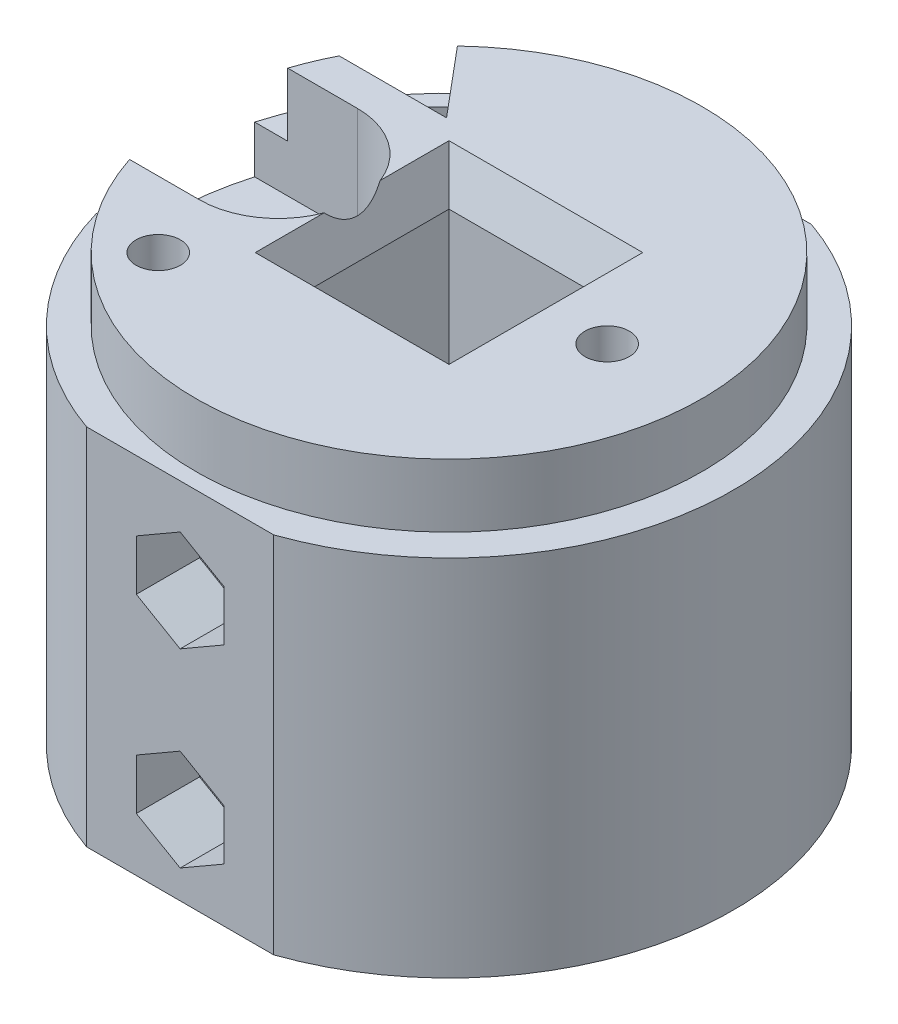
from build123d import *

# Parameters (mm, degrees)
SKETCH1_R           = 18
SKETCH1_R_2         = 2
SKETCH1_W           = 10.25
SKETCH1_H           = 10.25
BOSS_EXTRUDE1_DEPTH = 27
CUT_EXTRUDE1_START  = -7
CUT_EXTRUDE1_DEPTH  = 7
SKETCH4_W           = 9.35
SKETCH4_H           = 9.35
CUT_EXTRUDE3_DEPTH  = 15.4
CUT_EXTRUDE4_START  = -40
CUT_EXTRUDE4_DEPTH  = 40
SKETCH6_R           = 1.5
CUT_EXTRUDE5_DEPTH  = 48
SKETCH7_R           = 3
CUT_EXTRUDE6_DEPTH  = 3
CUT_EXTRUDE7_DEPTH  = 4
CHAMFER1_SIZE       = 1
CHAMFER1_SIZE_2     = 2.747477419
CUT_EXTRUDE8_DEPTH  = 37.633318168
SKETCH12_R          = 1.4
CUT_EXTRUDE10_DEPTH = 20
CUT_EXTRUDE9_START  = -4
SKETCH10_R          = 18
SKETCH10_R_2        = 16
CUT_EXTRUDE9_DEPTH  = 4


with BuildPart() as part:
    # Sketch1 → Boss-Extrude1 (new body)
    with BuildSketch(Plane(origin=(0, 0, 0), x_dir=(1, 0, 0), z_dir=(0, 1, 0))):
        with Locations(Location((0, 0, 0), (0, 0, 270))):
            Circle(SKETCH1_R)
        with Locations(Location((-12, 0, 0), (0, 0, 270))):
            Circle(SKETCH1_R_2, mode=Mode.SUBTRACT)
        Rectangle(SKETCH1_W, SKETCH1_H, mode=Mode.SUBTRACT)
    extrude(amount=BOSS_EXTRUDE1_DEPTH)

    # Sketch2 → Cut-Extrude1 (cut)
    with BuildSketch(Plane(origin=(0, 27, 0), x_dir=(1, 0, 0), z_dir=(0, 1, 0)).offset(CUT_EXTRUDE1_START)):
        with BuildLine():
            Line((-10.8, 5), (-17.291616466, 5))
            ThreePointArc((-17.291616466, 5), (-18, 0), (-17.291616466, -5))
            Line((-17.291616466, -5), (-10.8, -5))
            ThreePointArc((-10.8, -5), (-5.8, 0), (-10.8, 5))
        make_face()
    extrude(amount=CUT_EXTRUDE1_DEPTH, mode=Mode.SUBTRACT)

    # Sketch4 → Cut-Extrude3 (cut)
    with BuildSketch(Plane(origin=(0, 0, 0), x_dir=(-1, 0, 0), z_dir=(0, -1, 0))):
        with Locations((11.135393506, 0.872889968)):
            Rectangle(SKETCH4_W, SKETCH4_H)
    extrude(amount=-CUT_EXTRUDE3_DEPTH, mode=Mode.SUBTRACT)

    # Sketch5 → Cut-Extrude4 (cut)
    with BuildSketch(Plane(origin=(0, 27, 0), x_dir=(1, 0, 0), z_dir=(0, 1, 0)).offset(CUT_EXTRUDE4_START)):
        with BuildLine():
            Line((5.916079783, 17), (-5.916079783, 17))
            ThreePointArc((-5.916079783, 17), (0, 18), (5.916079783, 17))
        make_face()
        with BuildLine():
            Line((5.916079783, -17), (-5.916079783, -17))
            ThreePointArc((-5.916079783, -17), (0, -18), (5.916079783, -17))
        make_face()
    extrude(amount=CUT_EXTRUDE4_DEPTH, mode=Mode.SUBTRACT)

    # Sketch6 → Cut-Extrude5 (cut, through all)
    with BuildSketch(Plane(origin=(0, 0, -17), x_dir=(-1, 0, 0), z_dir=(0, 0, -1))):
        with Locations((0, 17)):
            Circle(SKETCH6_R)
        with Locations((0, 5)):
            Circle(SKETCH6_R)
    extrude(amount=-CUT_EXTRUDE5_DEPTH, mode=Mode.SUBTRACT)

    # Sketch7 → Cut-Extrude6 (cut)
    with BuildSketch(Plane(origin=(0, 0, -17), x_dir=(-1, 0, 0), z_dir=(0, 0, -1))):
        with Locations((0, 17)):
            Circle(SKETCH7_R)
        with Locations((0, 5)):
            Circle(SKETCH7_R)
    extrude(amount=-CUT_EXTRUDE6_DEPTH, mode=Mode.SUBTRACT)

    # Sketch8 → Cut-Extrude7 (cut)
    with BuildSketch(Plane.XY.offset(17)):
        Polygon((0, 13.8), (2.771281292, 15.4), (2.771281292, 18.6), (0, 20.2), (-2.771281292, 18.6), (-2.771281292, 15.4), align=None)
        Polygon((0, 1.8), (2.771281292, 3.4), (2.771281292, 6.6), (0, 8.2), (-2.771281292, 6.6), (-2.771281292, 3.4), align=None)
    extrude(amount=-CUT_EXTRUDE7_DEPTH, mode=Mode.SUBTRACT)

    # Chamfer1
    # the kernel refuses this chamfer: 2.747477419, 1 mm, written as the material it takes off along each edge
    with BuildSketch(Plane(origin=(-5.125, 27, -5.125), x_dir=(0, 0.09904090225204956, -0.9950833631817488), z_dir=(1, 0, 0)), Plane(origin=(-5.125, 27, 5.125), x_dir=(-0.9950833631817488, 0.09904090225204956, 0), z_dir=(0, 0, -1)), Plane(origin=(5.125, 27, 5.125), x_dir=(0, 0.09904090225204956, 0.9950833631817488), z_dir=(-1, 0, 0)), Plane(origin=(5.125, 27, -5.125), x_dir=(0.9950833631817488, 0.09904090225204956, 0), z_dir=(0, 0, 1))) as chamfer1_piece_1:
        Polygon((CHAMFER1_SIZE * 0.995083363182, -CHAMFER1_SIZE * 0.099040902252), (-CHAMFER1_SIZE_2 * 0.0990409022684, -CHAMFER1_SIZE_2 * 0.995083363346), (0, 0), align=None)
    extrude(amount=10.25, mode=Mode.SUBTRACT)
    with BuildSketch(Plane(origin=(-5.125, 27, 5.125), x_dir=(-0.9950833631817488, 0.09904090225204956, 0), z_dir=(0, 0, -1))) as chamfer1_piece_2a_section:
        Polygon((CHAMFER1_SIZE * 0.995083363182, -CHAMFER1_SIZE * 0.099040902252), (-CHAMFER1_SIZE_2 * 0.0990409022684, -CHAMFER1_SIZE_2 * 0.995083363346), (0, 0), align=None)
    chamfer1_piece_2a = extrude(amount=17.377491449, mode=Mode.PRIVATE)
    chamfer1_piece_2a = split(chamfer1_piece_2a, bisect_by=Plane(origin=(-5.432505006, 26.059901151, -5.125), z_dir=(0, 0, -1)), keep=Keep.TOP, mode=Mode.PRIVATE)
    with BuildSketch(Plane(origin=(-12.252491449, 27, -5.125), x_dir=(0, 0.09904090225204956, -0.9950833631817488), z_dir=(1, 0, 0))) as chamfer1_piece_2b_section:
        Polygon((CHAMFER1_SIZE * 0.995083363182, -CHAMFER1_SIZE * 0.099040902252), (-CHAMFER1_SIZE_2 * 0.0990409022684, -CHAMFER1_SIZE_2 * 0.995083363346), (0, 0), align=None)
    chamfer1_piece_2b = extrude(amount=17.377491449, mode=Mode.PRIVATE)
    chamfer1_piece_2b = split(chamfer1_piece_2b, bisect_by=Plane(origin=(-5.125, 26.059901151, -5.432505006), z_dir=(-1, 0, 0)), keep=Keep.TOP, mode=Mode.PRIVATE)
    chamfer1_piece_2 = chamfer1_piece_2a & chamfer1_piece_2b
    add(chamfer1_piece_2, mode=Mode.SUBTRACT)
    with BuildSketch(Plane(origin=(5.125, 27, -12.252491449), x_dir=(0.9950833631817488, 0.09904090225204956, 0), z_dir=(0, 0, 1))) as chamfer1_piece_3a_section:
        Polygon((CHAMFER1_SIZE * 0.995083363182, -CHAMFER1_SIZE * 0.099040902252), (-CHAMFER1_SIZE_2 * 0.0990409022684, -CHAMFER1_SIZE_2 * 0.995083363346), (0, 0), align=None)
    chamfer1_piece_3a = extrude(amount=17.377491449, mode=Mode.PRIVATE)
    chamfer1_piece_3a = split(chamfer1_piece_3a, bisect_by=Plane(origin=(5.432505006, 26.059901151, -5.125), z_dir=(0, 0, -1)), keep=Keep.TOP, mode=Mode.PRIVATE)
    with BuildSketch(Plane(origin=(-5.125, 27, -5.125), x_dir=(0, 0.09904090225204956, -0.9950833631817488), z_dir=(1, 0, 0))) as chamfer1_piece_3b_section:
        Polygon((CHAMFER1_SIZE * 0.995083363182, -CHAMFER1_SIZE * 0.099040902252), (-CHAMFER1_SIZE_2 * 0.0990409022684, -CHAMFER1_SIZE_2 * 0.995083363346), (0, 0), align=None)
    chamfer1_piece_3b = extrude(amount=17.377491449, mode=Mode.PRIVATE)
    chamfer1_piece_3b = split(chamfer1_piece_3b, bisect_by=Plane(origin=(5.125, 26.059901151, -5.432505006), z_dir=(1, 0, 0)), keep=Keep.TOP, mode=Mode.PRIVATE)
    chamfer1_piece_3 = chamfer1_piece_3a & chamfer1_piece_3b
    add(chamfer1_piece_3, mode=Mode.SUBTRACT)
    with BuildSketch(Plane(origin=(5.125, 27, 5.125), x_dir=(0, 0.09904090225204956, 0.9950833631817488), z_dir=(-1, 0, 0))) as chamfer1_piece_4a_section:
        Polygon((CHAMFER1_SIZE * 0.995083363182, -CHAMFER1_SIZE * 0.099040902252), (-CHAMFER1_SIZE_2 * 0.0990409022684, -CHAMFER1_SIZE_2 * 0.995083363346), (0, 0), align=None)
    chamfer1_piece_4a = extrude(amount=17.377491449, mode=Mode.PRIVATE)
    chamfer1_piece_4a = split(chamfer1_piece_4a, bisect_by=Plane(origin=(-5.125, 26.059901151, 5.432505006), z_dir=(-1, 0, 0)), keep=Keep.TOP, mode=Mode.PRIVATE)
    with BuildSketch(Plane(origin=(-5.125, 27, 12.252491449), x_dir=(-0.9950833631817488, 0.09904090225204956, 0), z_dir=(0, 0, -1))) as chamfer1_piece_4b_section:
        Polygon((CHAMFER1_SIZE * 0.995083363182, -CHAMFER1_SIZE * 0.099040902252), (-CHAMFER1_SIZE_2 * 0.0990409022684, -CHAMFER1_SIZE_2 * 0.995083363346), (0, 0), align=None)
    chamfer1_piece_4b = extrude(amount=17.377491449, mode=Mode.PRIVATE)
    chamfer1_piece_4b = split(chamfer1_piece_4b, bisect_by=Plane(origin=(-5.432505006, 26.059901151, 5.125), z_dir=(0, 0, 1)), keep=Keep.TOP, mode=Mode.PRIVATE)
    chamfer1_piece_4 = chamfer1_piece_4a & chamfer1_piece_4b
    add(chamfer1_piece_4, mode=Mode.SUBTRACT)
    with BuildSketch(Plane(origin=(12.252491449, 27, 5.125), x_dir=(0, 0.09904090225204956, 0.9950833631817488), z_dir=(-1, 0, 0))) as chamfer1_piece_5a_section:
        Polygon((CHAMFER1_SIZE * 0.995083363182, -CHAMFER1_SIZE * 0.099040902252), (-CHAMFER1_SIZE_2 * 0.0990409022684, -CHAMFER1_SIZE_2 * 0.995083363346), (0, 0), align=None)
    chamfer1_piece_5a = extrude(amount=17.377491449, mode=Mode.PRIVATE)
    chamfer1_piece_5a = split(chamfer1_piece_5a, bisect_by=Plane(origin=(5.125, 26.059901151, 5.432505006), z_dir=(1, 0, 0)), keep=Keep.TOP, mode=Mode.PRIVATE)
    with BuildSketch(Plane(origin=(5.125, 27, -5.125), x_dir=(0.9950833631817488, 0.09904090225204956, 0), z_dir=(0, 0, 1))) as chamfer1_piece_5b_section:
        Polygon((CHAMFER1_SIZE * 0.995083363182, -CHAMFER1_SIZE * 0.099040902252), (-CHAMFER1_SIZE_2 * 0.0990409022684, -CHAMFER1_SIZE_2 * 0.995083363346), (0, 0), align=None)
    chamfer1_piece_5b = extrude(amount=17.377491449, mode=Mode.PRIVATE)
    chamfer1_piece_5b = split(chamfer1_piece_5b, bisect_by=Plane(origin=(5.432505006, 26.059901151, 5.125), z_dir=(0, 0, 1)), keep=Keep.TOP, mode=Mode.PRIVATE)
    chamfer1_piece_5 = chamfer1_piece_5a & chamfer1_piece_5b
    add(chamfer1_piece_5, mode=Mode.SUBTRACT)

    # Sketch9 → Cut-Extrude8 (cut, through all)
    with BuildSketch(Plane.XZ):
        with BuildLine():
            Line((-7.454203172, -7.297889968), (-15.454203172, -7.297889968))
            ThreePointArc((-15.454203172, -7.297889968), (-13.761984914, -9.955415688), (-11.632322635, -12.277178848))
            Line((-11.632322635, -12.277178848), (-7.454203172, -7.297889968))
        make_face()
    extrude(amount=-CUT_EXTRUDE8_DEPTH, mode=Mode.SUBTRACT)

    # Sketch12 → Cut-Extrude10 (cut)
    with BuildSketch(Plane(origin=(0, 27, 0), x_dir=(1, 0, 0), z_dir=(0, 1, 0))):
        with Locations(Location((10, 0, 0), (0, 0, 270))):
            Circle(SKETCH12_R)
        with Locations(Location((-9.192388155, -9.192388155, 0), (0, 0, 270))):
            Circle(SKETCH12_R)
    extrude(amount=-CUT_EXTRUDE10_DEPTH, mode=Mode.SUBTRACT)

    # Sketch10 → Cut-Extrude9 (cut)
    with BuildSketch(Plane(origin=(0, 27, 0), x_dir=(1, 0, 0), z_dir=(0, 1, 0)).offset(CUT_EXTRUDE9_START)):
        Circle(SKETCH10_R)
        Circle(SKETCH10_R_2, mode=Mode.SUBTRACT)
    extrude(amount=CUT_EXTRUDE9_DEPTH, mode=Mode.SUBTRACT)


solid = part.part
